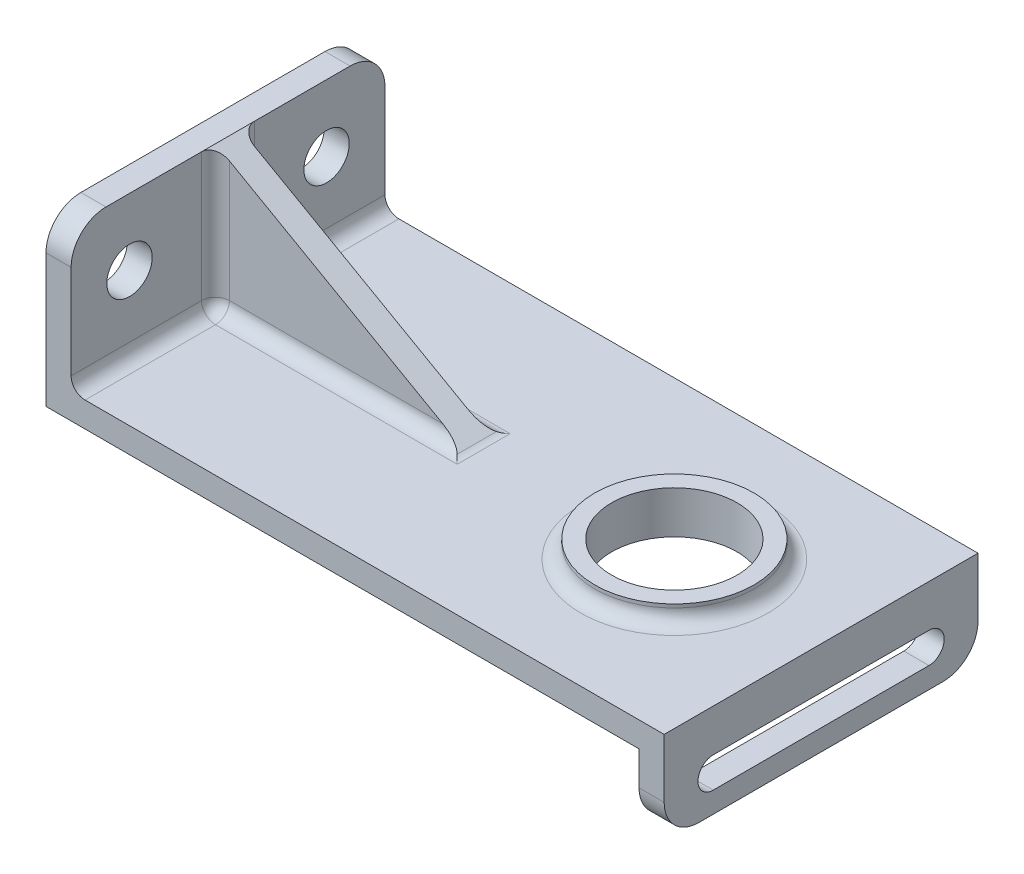
from build123d import *

# Parameters (mm, degrees)
EXTRUDE1_DEPTH = 57.15
SKETCH2_R      = 14.506414019
EXTRUDE2_DEPTH = 3.175
FILLET1_R      = 2.54
SKETCH3_R      = 11.421445599
EXTRUDE3_DEPTH = 15.875
EXTRUDE4_DEPTH = 2.286
FILLET4_R      = 2.54
FILLET5_R      = 6.35
EXTRUDE5_DEPTH = 4.572
SKETCH6_R      = 4.134080516
EXTRUDE6_DEPTH = 4.572


with BuildPart() as part:
    # Sketch1 → Extrude1 (new body)
    with BuildSketch(Plane.XY):
        Polygon((0, 30.576970443), (0, 0), (107.990032379, 0), (107.990032379, -12.496674877), (112.562032379, -12.496674877), (112.562032379, 4.572), (4.572, 4.572), (4.572, 30.576970443), align=None)
    extrude(amount=EXTRUDE1_DEPTH)

    # Sketch2 → Extrude2 (add)
    with BuildSketch(Plane(origin=(0, 4.572, 0), x_dir=(-1, 0, 0), z_dir=(0, 1, 0))):
        with Locations(Location((-85.846627335, 28.575, 0), (0, 0, 270))):
            Circle(SKETCH2_R)
    extrude(amount=EXTRUDE2_DEPTH)

    # Fillet1
    fillet1_edges = [part.edges().sort_by_distance(p)[0] for p in [
        (85.846627335, 4.572, 43.081414019),
    ]]
    fillet(fillet1_edges, radius=FILLET1_R)

    # Sketch3 → Extrude3 (cut)
    with BuildSketch(Plane(origin=(0, 7.747, 0), x_dir=(-1, 0, 0), z_dir=(0, 1, 0))):
        with Locations(Location((-85.846627335, 28.575, 0), (0, 0, 90))):
            Circle(SKETCH3_R)
    extrude(amount=-EXTRUDE3_DEPTH, mode=Mode.SUBTRACT)

    # Sketch4 → Extrude4 (add, symmetric)
    with BuildSketch(Plane.XY.offset(28.575)):
        Polygon((4.572, 30.576970443), (50.451305306, 4.572), (4.572, 4.572), align=None)
    extrude(amount=EXTRUDE4_DEPTH, both=True)

    # Fillet4
    fillet4_edges = [part.edges().sort_by_distance(p)[0] for p in [
        (27.511652653, 4.572, 26.289),
    ]]
    fillet(fillet4_edges, radius=FILLET4_R)
    fillet4_2_edges = [part.edges().sort_by_distance(p)[0] for p in [
        (27.511652653, 4.572, 30.861),
    ]]
    fillet(fillet4_2_edges, radius=FILLET4_R)
    fillet4_3_edges = [part.edges().sort_by_distance(p)[0] for p in [
        (50.451305306, 4.572, 28.575),
    ]]
    fillet(fillet4_3_edges, radius=FILLET4_R)
    # the kernel refuses this fillet: 2.54 mm, written as the material it adds along each edge
    with BuildSketch(Plane(origin=(4.572, 4.572, 0), x_dir=(1, 0, 0), z_dir=(0, 0, 1))) as fillet4_4_piece_1:
        with BuildLine():
            CenterArc((FILLET4_R, FILLET4_R), FILLET4_R, 180, 90)
            Line((0, FILLET4_R), (-FILLET4_R * 0.02, FILLET4_R))
            Line((-FILLET4_R * 0.02, FILLET4_R), (-FILLET4_R * 0.02, -FILLET4_R * 0.02))
            Line((-FILLET4_R * 0.02, -FILLET4_R * 0.02), (FILLET4_R, -FILLET4_R * 0.02))
            Line((FILLET4_R, -FILLET4_R * 0.02), (FILLET4_R, 0))
        make_face()
    extrude(amount=23.749)
    with BuildSketch(Plane(origin=(4.572, 7.112, 23.749), x_dir=(0, -1, 0), z_dir=(0, 0, -1))) as fillet4_4_piece_2:
        with BuildLine():
            CenterArc((2.54 - FILLET4_R, -FILLET4_R), FILLET4_R, 0, 90)
            Line((2.54 - FILLET4_R, 0), (2.54 - FILLET4_R, FILLET4_R * 0.02))
            Line((2.54 - FILLET4_R, FILLET4_R * 0.02), (2.54, FILLET4_R * 0.02))
            Line((2.54, FILLET4_R * 0.02), (2.54 + FILLET4_R * 0.02, 0))
            Line((2.54 + FILLET4_R * 0.02, 0), (2.54 + FILLET4_R * 0.02, -FILLET4_R))
            Line((2.54 + FILLET4_R * 0.02, -FILLET4_R), (2.54, -FILLET4_R))
        make_face()
    revolve(axis=Axis((4.572, 7.112, 23.749), (-1, 0, 0)), revolution_arc=90)
    with BuildSketch(Plane(origin=(4.572, 7.112, 26.289), x_dir=(0, 0, -1), z_dir=(0, 1, 0))) as fillet4_4_piece_3_section:
        with BuildLine():
            CenterArc((FILLET4_R, -FILLET4_R), FILLET4_R, 90, 90)
            Line((0, -FILLET4_R), (-FILLET4_R * 0.02, -FILLET4_R))
            Line((-FILLET4_R * 0.02, -FILLET4_R), (-FILLET4_R * 0.02, FILLET4_R * 0.02))
            Line((-FILLET4_R * 0.02, FILLET4_R * 0.02), (FILLET4_R, FILLET4_R * 0.02))
            Line((FILLET4_R, FILLET4_R * 0.02), (FILLET4_R, 0))
        make_face()
    fillet4_4_piece_3 = extrude(amount=23.464970443, mode=Mode.PRIVATE)
    fillet4_4_piece_3 = split(fillet4_4_piece_3, bisect_by=Plane(origin=(10.10405857, 27.441329687, 25.709650316), z_dir=(-0.49310869822243814, -0.8699677072957206, 0)), keep=Keep.TOP, mode=Mode.PRIVATE)
    add(fillet4_4_piece_3)
    # the kernel refuses this fillet: 2.54 mm, written as the material it adds along each edge
    with BuildSketch(Plane(origin=(4.572, 4.572, 33.401), x_dir=(1, 0, 0), z_dir=(0, 0, 1))) as fillet4_5_piece_1:
        with BuildLine():
            CenterArc((FILLET4_R, FILLET4_R), FILLET4_R, 180, 90)
            Line((0, FILLET4_R), (-FILLET4_R * 0.02, FILLET4_R))
            Line((-FILLET4_R * 0.02, FILLET4_R), (-FILLET4_R * 0.02, -FILLET4_R * 0.02))
            Line((-FILLET4_R * 0.02, -FILLET4_R * 0.02), (FILLET4_R, -FILLET4_R * 0.02))
            Line((FILLET4_R, -FILLET4_R * 0.02), (FILLET4_R, 0))
        make_face()
    extrude(amount=23.749)
    with BuildSketch(Plane(origin=(4.572, 7.112, 33.401), x_dir=(0, -1, 0), z_dir=(0, 0, 1))) as fillet4_5_piece_2:
        with BuildLine():
            CenterArc((2.54 - FILLET4_R, FILLET4_R), FILLET4_R, 270, 90)
            Line((2.54 - FILLET4_R, 0), (2.54 - FILLET4_R, -FILLET4_R * 0.02))
            Line((2.54 - FILLET4_R, -FILLET4_R * 0.02), (2.54, -FILLET4_R * 0.02))
            Line((2.54, -FILLET4_R * 0.02), (2.54 + FILLET4_R * 0.02, 0))
            Line((2.54 + FILLET4_R * 0.02, 0), (2.54 + FILLET4_R * 0.02, FILLET4_R))
            Line((2.54 + FILLET4_R * 0.02, FILLET4_R), (2.54, FILLET4_R))
        make_face()
    revolve(axis=Axis((4.572, 7.112, 33.401), (1, 0, 0)), revolution_arc=90)
    with BuildSketch(Plane(origin=(4.572, 7.112, 30.861), x_dir=(1, 0, 0), z_dir=(0, 1, 0))) as fillet4_5_piece_3_section:
        with BuildLine():
            CenterArc((FILLET4_R, -FILLET4_R), FILLET4_R, 90, 90)
            Line((0, -FILLET4_R), (-FILLET4_R * 0.02, -FILLET4_R))
            Line((-FILLET4_R * 0.02, -FILLET4_R), (-FILLET4_R * 0.02, FILLET4_R * 0.02))
            Line((-FILLET4_R * 0.02, FILLET4_R * 0.02), (FILLET4_R, FILLET4_R * 0.02))
            Line((FILLET4_R, FILLET4_R * 0.02), (FILLET4_R, 0))
        make_face()
    fillet4_5_piece_3 = extrude(amount=23.464970443, mode=Mode.PRIVATE)
    fillet4_5_piece_3 = split(fillet4_5_piece_3, bisect_by=Plane(origin=(10.10405857, 27.441329687, 31.440349684), z_dir=(-0.49310869822243814, -0.8699677072957206, 0)), keep=Keep.TOP, mode=Mode.PRIVATE)
    add(fillet4_5_piece_3)

    # Fillet5
    fillet5_edges = [part.edges().sort_by_distance(p)[0] for p in [
        (2.286, 30.576970443, 0),
        (110.276032379, -12.496674877, 57.15),
        (2.286, 30.576970443, 57.15),
        (110.276032379, -12.496674877, 0),
    ]]
    fillet(fillet5_edges, radius=FILLET5_R)

    # Sketch5 → Extrude5 (cut)
    with BuildSketch(Plane(origin=(112.562032379, 0, 0), x_dir=(0, 0, -1), z_dir=(1, 0, 0))):
        with BuildLine():
            Line((-48.21617711, -3.129971145), (-8.93382289, -3.129971145))
            ThreePointArc((-8.93382289, -3.129971145), (-6.157220398, -5.906573636), (-8.93382289, -8.683176127))
            Line((-8.93382289, -8.683176127), (-48.21617711, -8.683176127))
            ThreePointArc((-48.21617711, -8.683176127), (-50.992779602, -5.906573636), (-48.21617711, -3.129971145))
        make_face()
    extrude(amount=-EXTRUDE5_DEPTH, mode=Mode.SUBTRACT)

    # Sketch6 → Extrude6 (cut)
    with BuildSketch(Plane(origin=(4.572, 0, 0), x_dir=(0, 0, -1), z_dir=(1, 0, 0))):
        with Locations((-46.51308259, 18.4320182)):
            Circle(SKETCH6_R)
        with Locations(Location((-10.63691741, 18.4320182, 0), (0, 0, 180))):
            Circle(SKETCH6_R)
    extrude(amount=-EXTRUDE6_DEPTH, mode=Mode.SUBTRACT)


solid = part.part
